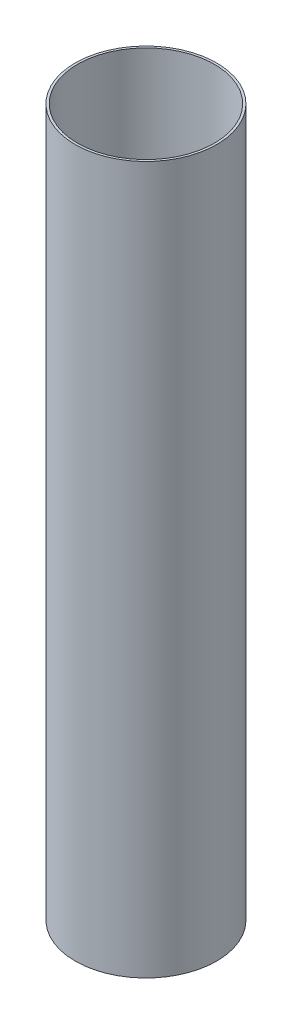
from build123d import *

# Parameters (mm, degrees)
SKETCH1_R           = 31
BOSS_EXTRUDE1_DEPTH = 310
SKETCH2_R           = 30
CUT_EXTRUDE1_DEPTH  = 300


with BuildPart() as part:
    # Sketch1 → Boss-Extrude1 (new body)
    with BuildSketch(Plane(origin=(0, 0, 0), x_dir=(1, 0, 0), z_dir=(0, 1, 0))):
        Circle(SKETCH1_R)
    extrude(amount=BOSS_EXTRUDE1_DEPTH)

    # Sketch2 → Cut-Extrude1 (cut)
    with BuildSketch(Plane(origin=(0, 310, 0), x_dir=(1, 0, 0), z_dir=(0, 1, 0))):
        Circle(SKETCH2_R)
    extrude(amount=-CUT_EXTRUDE1_DEPTH, mode=Mode.SUBTRACT)


solid = part.part
